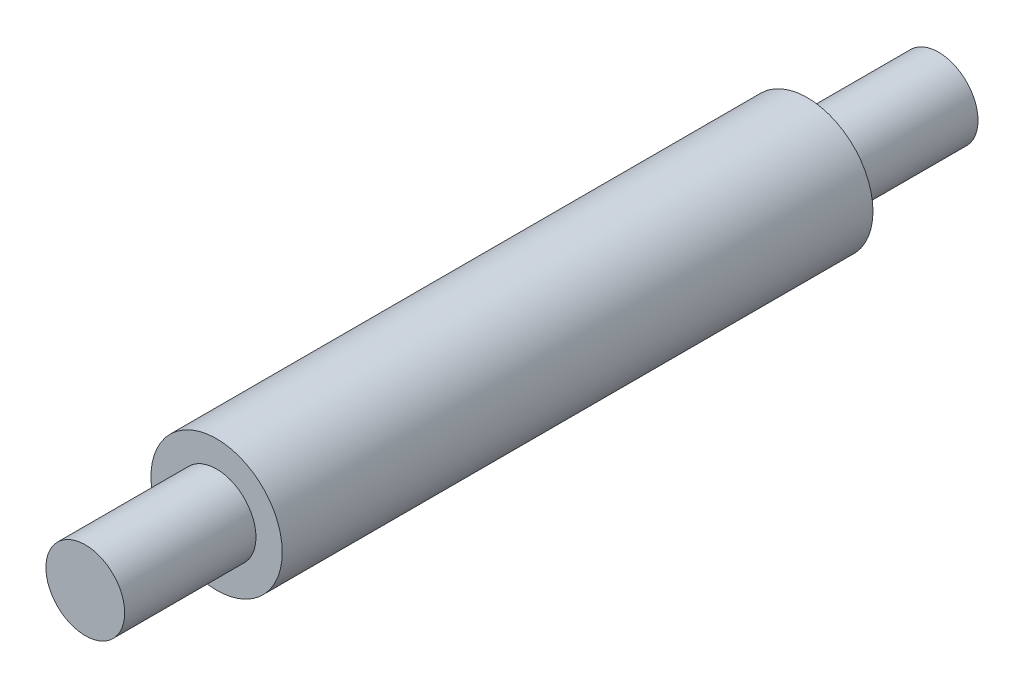
from build123d import *


with BuildPart() as part:
    # Sketch6 → Revolve1 (revolve)
    with BuildSketch(Plane(origin=(0, 0, 0), x_dir=(0, 0, -1), z_dir=(1, 0, 0))):
        Polygon((0, 0), (65, 0), (65, 3), (55, 3), (55, 5), (10, 5), (10, 3), (0, 3), align=None)
    revolve(axis=Axis((0, 0, 0), (0, 0, -1)))


solid = part.part
